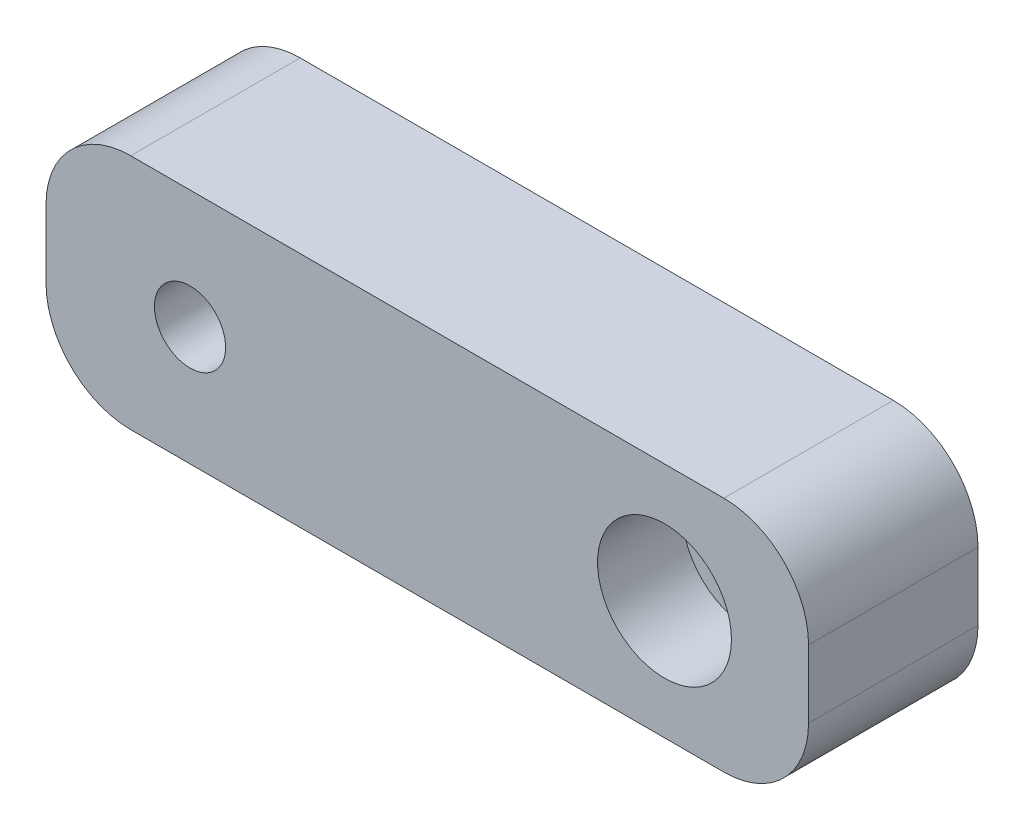
from build123d import *

# Parameters (mm, degrees)
SKETCH1_W           = 45
SKETCH1_H           = 14
BOSS_EXTRUDE1_DEPTH = 10
FILLET1_R           = 5
FILLET2_R           = 5
SKETCH2_R           = 4
CUT_EXTRUDE2_DEPTH  = 2.5
SKETCH3_R           = 2.1
CUT_EXTRUDE3_DEPTH  = 2
SKETCH4_R           = 3.95
CUT_EXTRUDE4_DEPTH  = 5
CUT_EXTRUDE5_REACH  = 64.926
SKETCH5_R           = 2
SKETCH7_R           = 2.1
CUT_EXTRUDE6_DEPTH  = 63.967570185


with BuildPart() as part:
    # Sketch1 → Boss-Extrude1 (new body)
    with BuildSketch(Plane.XY):
        with Locations((-36.850618243, 13.301945946)):
            Rectangle(SKETCH1_W, SKETCH1_H)
    extrude(amount=BOSS_EXTRUDE1_DEPTH)

    # Fillet1
    fillet1_edges = [part.edges().sort_by_distance(p)[0] for p in [
        (-59.350618243, 20.301945946, 5),
    ]]
    fillet(fillet1_edges, radius=FILLET1_R)

    # Fillet2
    fillet2_edges = [part.edges().sort_by_distance(p)[0] for p in [
        (-14.350618243, 6.301945946, 5),
        (-14.350618243, 20.301945946, 5),
        (-59.350618243, 6.301945946, 5),
    ]]
    fillet(fillet2_edges, radius=FILLET2_R)

    # Sketch2 → Cut-Extrude2 (cut)
    with BuildSketch(Plane(origin=(0, 0, 0), x_dir=(-1, 0, 0), z_dir=(0, 0, -1))):
        with Locations((50.850618243, 13.301945946)):
            Circle(SKETCH2_R)
    extrude(amount=-CUT_EXTRUDE2_DEPTH, mode=Mode.SUBTRACT)

    # Sketch3 → Cut-Extrude3 (cut)
    with BuildSketch(Plane(origin=(0, 0, 2.5), x_dir=(-1, 0, 0), z_dir=(0, 0, -1))):
        with Locations((50.850618243, 13.301945946)):
            Circle(SKETCH3_R)
    extrude(amount=-CUT_EXTRUDE3_DEPTH, mode=Mode.SUBTRACT)

    # Sketch4 → Cut-Extrude4 (cut)
    with BuildSketch(Plane.XY.offset(10)):
        with Locations((-22.850618243, 13.301945946)):
            Circle(SKETCH4_R)
    extrude(amount=-CUT_EXTRUDE4_DEPTH, mode=Mode.SUBTRACT)

    # Sketch5 → Cut-Extrude5 (cut, up to next)
    with BuildSketch(Plane.XY.offset(5), mode=Mode.PRIVATE) as cut_extrude5_sk1:
        with Locations((-22.850618243, 13.301945946)):
            Circle(SKETCH5_R)
    cut_extrude5_tool1 = extrude(cut_extrude5_sk1.sketch, amount=-CUT_EXTRUDE5_REACH, mode=Mode.PRIVATE) & part.part
    add(cut_extrude5_tool1.solids().sort_by_distance((-22.850618, 13.301946, 5))[0], mode=Mode.SUBTRACT)

    # Sketch7 → Cut-Extrude6 (cut, through all)
    with BuildSketch(Plane(origin=(0, 0, 4.5), x_dir=(-1, 0, 0), z_dir=(0, 0, -1))):
        with Locations((50.850618243, 13.301945946)):
            Circle(SKETCH7_R)
    extrude(amount=-CUT_EXTRUDE6_DEPTH, mode=Mode.SUBTRACT)


solid = part.part
